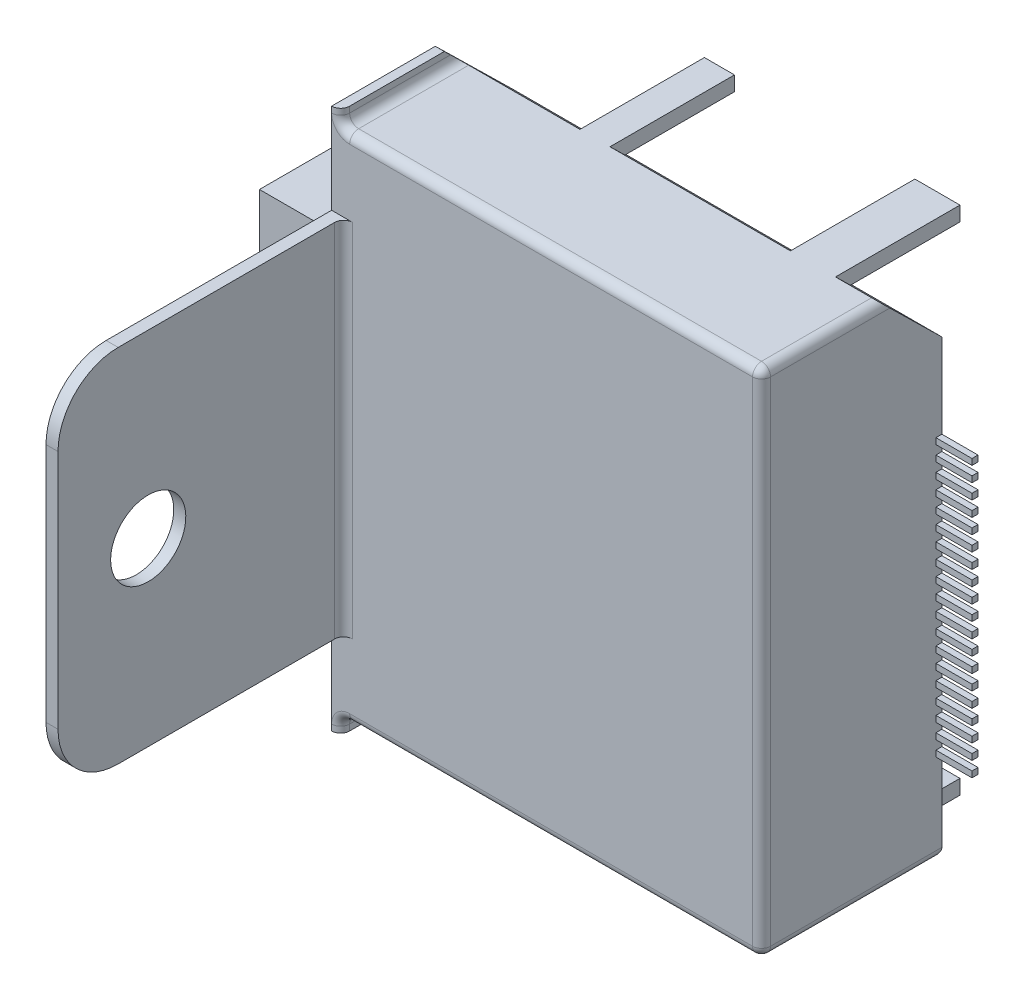
from build123d import *

# Parameters (mm, degrees)
SKETCH_1_W             = 14.3
SKETCH_1_H             = 17
EXTRUDE_1_DEPTH        = 6
SKETCH_3_W             = 0.2
SKETCH_3_H             = 0.2
EXTRUDE_3_DEPTH        = 1.2
PATTERN_LINEAR_1_COUNT = 19
PATTERN_LINEAR_1_PITCH = 0.5
SKETCH_4_W             = 0.3
SKETCH_4_H             = 0.5
EXTRUDE_4_DEPTH        = 6
CUT_EXTRUDE_1_DEPTH    = 10
SKETCH_8_W             = 0.883352336
SKETCH_8_H             = 11.931096145
EXTRUDE_6_DEPTH        = 5.2
CUT_EXTRUDE_4_DEPTH    = 24.382472068
EXTRUDE_7_DEPTH        = 2.1
EXTRUDE_7_DEPTH_BACK   = 5.2
SKETCH_12_W            = 1.5
SKETCH_12_H            = 0.486445161
SKETCH_12_W_2          = 1
SKETCH_13_R            = 0.6
EXTRUDE_8_DEPTH        = 2
SKETCH_15_R            = 1.25
EXTRUDE_9_DEPTH        = 0.4
SKETCH_16_W            = 4.2
SKETCH_16_H            = 9
EXTRUDE_10_DEPTH       = 3.3
FILLET_1_R             = 0.3


with BuildPart() as part:
    # 草图1 → 凸台-拉伸1 (new body)
    with BuildSketch(Plane.XY):
        with Locations((7.15, -8.5)):
            Rectangle(SKETCH_1_W, SKETCH_1_H)
    extrude(amount=EXTRUDE_1_DEPTH)

    # 草图3 → 凸台-拉伸3 (add)
    with BuildSketch(Plane(origin=(14.3, 0, 0), x_dir=(0, 0, -1), z_dir=(1, 0, 0))):
        with Locations((-0.1, -13.9)):
            Rectangle(SKETCH_3_W, SKETCH_3_H)
    extrude_3 = extrude(amount=EXTRUDE_3_DEPTH)

    # 阵列(线性)1: 凸台-拉伸3 ×19
    with Locations(*[(0, i * PATTERN_LINEAR_1_PITCH, 0) for i in range(1, PATTERN_LINEAR_1_COUNT)]):
        add(extrude_3)

    # 草图4 → 凸台-拉伸4 (add)
    with BuildSketch(Plane.XY.offset(6)):
        with Locations((0.15, 0.25)):
            Rectangle(SKETCH_4_W, SKETCH_4_H)
        with Locations((0.15, -17.25)):
            Rectangle(SKETCH_4_W, SKETCH_4_H)
    extrude(amount=-EXTRUDE_4_DEPTH)

    # 草图6 → 切除-拉伸1 (cut)
    with BuildSketch(Plane.ZY):
        Polygon((0.814275945, -1.576993803), (1.814275945, -0.576993803), (5.086945076, -0.576993803), (5.086945076, -16.573920601), (0.814275945, -16.573920601), align=None)
    extrude(amount=-CUT_EXTRUDE_1_DEPTH, mode=Mode.SUBTRACT)

    # 草图8 → 凸台-拉伸6 (add)
    with BuildSketch(Plane.ZY.offset(-10)):
        with Locations((2.941004683, -8.691870864)):
            Rectangle(SKETCH_8_W, SKETCH_8_H)
    extrude(amount=EXTRUDE_6_DEPTH)

    # 草图11 → 切除-拉伸4 (cut, through all)
    with BuildSketch(Plane(origin=(14.3, 0, 0), x_dir=(0, 0, -1), z_dir=(1, 0, 0))):
        Polygon((-2.744957318, 0.690687189), (0.440532754, -2.430132002), (0.440532754, 0.690687189), align=None)
    extrude(amount=-CUT_EXTRUDE_4_DEPTH, mode=Mode.SUBTRACT)

    # 草图12 → 凸台-拉伸7 (add, two sides: drawn at the far end of the back side and taken through both)
    with BuildSketch(Plane(origin=(0, 0, 0), x_dir=(-1, 0, 0), z_dir=(0, 0, -1)).offset(-EXTRUDE_7_DEPTH_BACK)):
        with Locations((-12.05, -16.75677742)):
            Rectangle(SKETCH_12_W, SKETCH_12_H)
        with Locations((-4.8, -16.75677742)):
            Rectangle(SKETCH_12_W_2, SKETCH_12_H)
        with Locations((-4.8, -0.243222581)):
            Rectangle(SKETCH_12_W_2, SKETCH_12_H)
        with Locations((-12.05, -0.243222581)):
            Rectangle(SKETCH_12_W, SKETCH_12_H)
    extrude(amount=EXTRUDE_7_DEPTH + EXTRUDE_7_DEPTH_BACK)

    # 草图13 → 凸台-拉伸8 (add)
    with BuildSketch(Plane(origin=(0, 0, 0), x_dir=(-1, 0, 0), z_dir=(0, 0, -1))):
        with Locations(Location((-4.5, -8.757432115, 0), (0, 0, 180))):
            Circle(SKETCH_13_R)
    extrude(amount=EXTRUDE_8_DEPTH)

    # 草图15 → 凸台-拉伸9 (add)
    with BuildSketch(Plane.ZY):
        with BuildLine():
            Line((6, -2.5), (13.5, -2.5))
            ThreePointArc((13.5, -2.5), (14.914213562, -3.085786438), (15.5, -4.5))
            Line((15.5, -4.5), (15.5, -12.5))
            ThreePointArc((15.5, -12.5), (14.914213562, -13.914213562), (13.5, -14.5))
            Line((13.5, -14.5), (6, -14.5))
            Line((6, -14.5), (6, -2.5))
        make_face()
        with Locations(Location((12.5, -8.5, 0), (0, 0, 270))):
            Circle(SKETCH_15_R, mode=Mode.SUBTRACT)
    extrude(amount=-EXTRUDE_9_DEPTH)

    # 草图16 → 凸台-拉伸10 (add)
    with BuildSketch(Plane.ZY):
        with Locations((3, -8.5)):
            Rectangle(SKETCH_16_W, SKETCH_16_H)
    extrude(amount=EXTRUDE_10_DEPTH)

    # 圆角1
    fillet_1_edges = [part.edges().sort_by_distance(p)[0] for p in [
        (0.3, 0.25, 6),
        (0.3, -17.25, 0),
        (0.3, -17.25, 6),
        (0.3, 0, 4.019978715),
        (0.4, -8.5, 6),
        (0.3, -17, 3),
        (2.3, -17, 0),
        (8.3, -17, 0),
        (13.55, -17, 0),
        (14.3, -17, 3),
        (7.3, -17, 6),
        (14.3, 0, 4.019978715),
        (14.3, -8.5, 6),
        (7.3, 0, 6),
    ]]
    fillet(fillet_1_edges, radius=FILLET_1_R - 0.0001)  # a hair under: the kernel refuses the full size


solid = part.part
